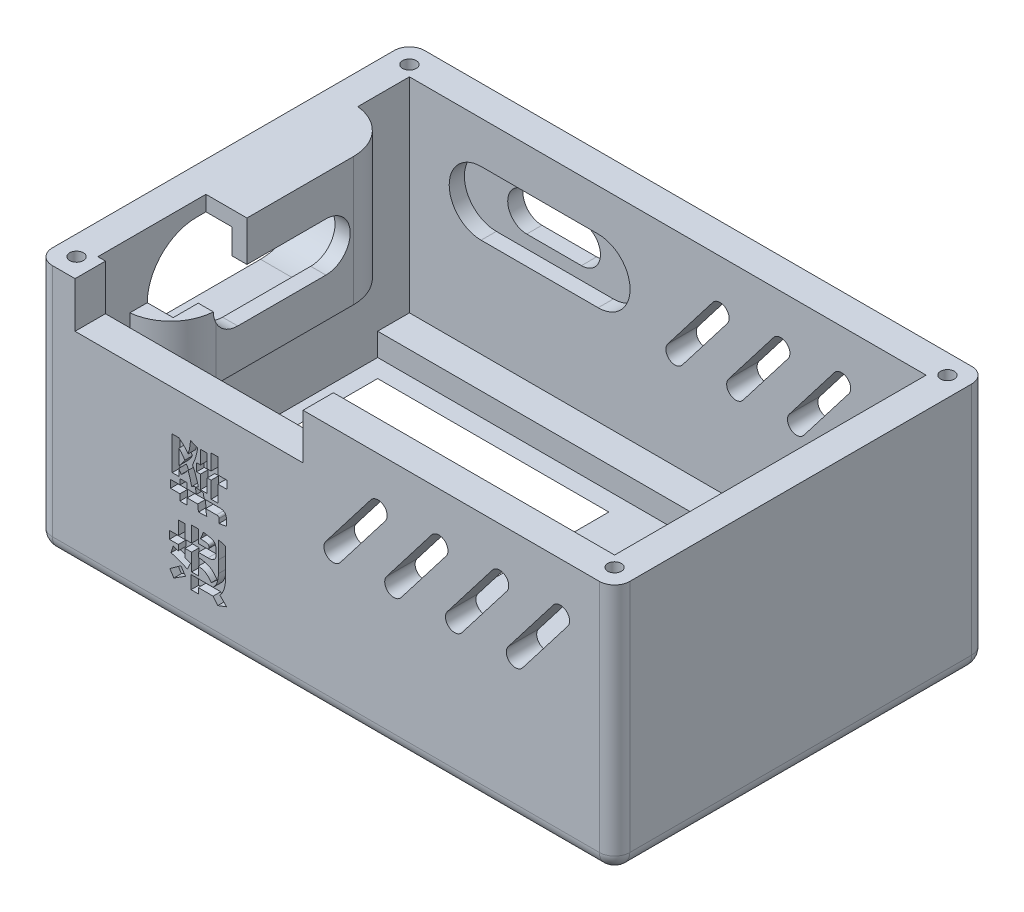
from build123d import *

# Parameters (mm, degrees)
SKETCH_1_W           = 38
SKETCH_1_H           = 24.5
EXTRUDE_1_DEPTH      = 16.45
SKETCH_2_W           = 34
SKETCH_2_H           = 20.5
CUT_EXTRUDE_1_DEPTH  = 13.45
SKETCH_4_W           = 15.21
SKETCH_4_H           = 15.21
CUT_EXTRUDE_2_DEPTH  = 15
SKETCH_6_W           = 15
SKETCH_6_H           = 3
CUT_EXTRUDE_4_DEPTH  = 5
SKETCH_11_W          = 32.5
SKETCH_11_H          = 17.6
CUT_EXTRUDE_10_DEPTH = 1.5
FILLET_2_R           = 1
CHAMFER_2_SIZE       = 1.5
FILLET_8_R           = 1
SKETCH_24_W          = 7
SKETCH_24_H          = 9.5
CUT_EXTRUDE_17_DEPTH = 1
SKETCH_29_R          = 0.45
CUT_EXTRUDE_18_DEPTH = 6
CUT_EXTRUDE_19_DEPTH = 1
CUT_EXTRUDE_20_REACH = 79.65
SKETCH_37_W          = 3
SKETCH_37_H          = 15
EXTRUDE_8_DEPTH      = 10
CUT_EXTRUDE_21_DEPTH = 3.7
CUT_EXTRUDE_24_DEPTH = 9
FILLET_9_R           = 3
SKETCH_42_W          = 0.402439024
SKETCH_42_H          = 0.439596036
SKETCH_42_H_2        = 0.416730183
SKETCH_42_W_2        = 0.365853658
SKETCH_42_W_3        = 1.207317074
SKETCH_42_H_3        = 0.173780487
CUT_EXTRUDE_26_DEPTH = 0.5
CUT_EXTRUDE_27_DEPTH = 0.5
CUT_EXTRUDE_START    = -2.7
SKETCH_46_W          = 15
SKETCH_46_H          = 5
CUT_EXTRUDE_29_DEPTH = 2.7
SKETCH_48_W          = 1.781169501
SKETCH_48_H          = 2
EXTRUDE_9_DEPTH      = 1.4
SKETCH_49_W          = 1
SKETCH_49_H          = 7
CUT_EXTRUDE_30_DEPTH = 1.5
CUT_EXTRUDE_31_DEPTH = 78.958761426
SKETCH_51_W          = 2
SKETCH_51_H          = 19
CUT_EXTRUDE_32_DEPTH = 0.5
SKETCH_52_W          = 2
SKETCH_52_H          = 0.5
EXTRUDE_10_DEPTH     = 0.5
SKETCH_53_W          = 2.7
SKETCH_53_H          = 5.005825876
CUT_EXTRUDE_33_DEPTH = 4.25
SKETCH_54_R          = 2
CUT_EXTRUDE_34_DEPTH = 0.5


# Some blends are built 0.0001 mm under size
with BuildPart() as part:
    # 草图1 → 凸台-拉伸1 (new body)
    with BuildSketch(Plane(origin=(0, 0, 0), x_dir=(1, 0, 0), z_dir=(0, 1, 0))):
        with Locations((-53.157577391, -18.500418409)):
            Rectangle(SKETCH_1_W, SKETCH_1_H)
    extrude(amount=EXTRUDE_1_DEPTH)

    # 草图2 → 切除-拉伸1 (cut)
    with BuildSketch(Plane(origin=(0, 16.45, 0), x_dir=(1, 0, 0), z_dir=(0, 1, 0))):
        with Locations((-53.157577391, -18.500418409)):
            Rectangle(SKETCH_2_W, SKETCH_2_H)
    extrude(amount=-CUT_EXTRUDE_1_DEPTH, mode=Mode.SUBTRACT)

    # 草图4 → 切除-拉伸2 (cut)
    with BuildSketch(Plane(origin=(0, 0, 0), x_dir=(-1, 0, 0), z_dir=(0, -1, 0))):
        with Locations((61.352577391, -19.145418409)):
            Rectangle(SKETCH_4_W, SKETCH_4_H)
    extrude(amount=-CUT_EXTRUDE_2_DEPTH, mode=Mode.SUBTRACT)

    # 草图6 → 切除-拉伸4 (cut)
    with BuildSketch(Plane.XY.offset(30.750418409)):
        with Locations((-62.157577391, 14.95)):
            Rectangle(SKETCH_6_W, SKETCH_6_H)
    extrude(amount=-CUT_EXTRUDE_4_DEPTH, mode=Mode.SUBTRACT)

    # 草图11 → 切除-拉伸10 (cut)
    with BuildSketch(Plane(origin=(0, 3, 0), x_dir=(1, 0, 0), z_dir=(0, 1, 0))):
        with Locations((-53.907577391, -19.140418409)):
            Rectangle(SKETCH_11_W, SKETCH_11_H)
    extrude(amount=-CUT_EXTRUDE_10_DEPTH, mode=Mode.SUBTRACT)

    # 圆角2
    fillet_2_edges = [part.edges().sort_by_distance(p)[0] for p in [
        (-72.157577391, 0, 18.500418409),
        (-53.157577391, 0, 30.750418409),
        (-34.157577391, 0, 18.500418409),
        (-53.157577391, 0, 6.250418409),
        (-72.157577391, 8.225, 6.250418409),
        (-72.157577391, 8.225, 30.750418409),
        (-34.157577391, 8.225, 30.750418409),
        (-34.157577391, 8.225, 6.250418409),
    ]]
    fillet(fillet_2_edges, radius=FILLET_2_R)

    # 倒角2
    chamfer_2_edges = [part.edges().sort_by_distance(p)[0] for p in [
        (-61.352577391, 0, 26.750418409),
        (-53.747577391, 0, 19.145418409),
        (-61.352577391, 0, 11.540418409),
        (-68.957577391, 0, 19.145418409),
    ]]
    chamfer(chamfer_2_edges, length=CHAMFER_2_SIZE - 0.0001)  # a hair under: the kernel refuses the full size

    # 圆角8
    fillet_8_edges = [part.edges().sort_by_distance(p)[0] for p in [
        (-37.657577391, 3, 19.140418409),
    ]]
    fillet(fillet_8_edges, radius=FILLET_8_R)

    # 草图24 → 切除-拉伸17 (cut)
    with BuildSketch(Plane.ZY.offset(36.157577391)):
        with Locations((19.140418409, 7.75)):
            Rectangle(SKETCH_24_W, SKETCH_24_H)
    extrude(amount=-CUT_EXTRUDE_17_DEPTH, mode=Mode.SUBTRACT)

    # 草图29 → 切除-拉伸18 (cut)
    with BuildSketch(Plane(origin=(0, 16.45, 0), x_dir=(1, 0, 0), z_dir=(0, 1, 0))):
        with Locations(Location((-70.857577391, -7.550418409, 0), (0, 0, 270))):
            Circle(SKETCH_29_R)
        with Locations(Location((-70.857577391, -29.450418409, 0), (0, 0, 270))):
            Circle(SKETCH_29_R)
        with Locations(Location((-35.457577391, -7.550418409, 0), (0, 0, 270))):
            Circle(SKETCH_29_R)
        with Locations(Location((-35.457577391, -29.450418409, 0), (0, 0, 270))):
            Circle(SKETCH_29_R)
    extrude(amount=-CUT_EXTRUDE_18_DEPTH, mode=Mode.SUBTRACT)

    # 草图32 → 切除-拉伸19 (cut)
    with BuildSketch(Plane.XY.offset(8.250418409)):
        with BuildLine():
            Line((-57.739407383, 9.5), (-65.439407383, 9.5))
            ThreePointArc((-65.439407383, 9.5), (-67.539407383, 11.6), (-65.439407383, 13.7))
            Line((-65.439407383, 13.7), (-57.739407383, 13.7))
            ThreePointArc((-57.739407383, 13.7), (-55.639407383, 11.6), (-57.739407383, 9.5))
        make_face()
    extrude(amount=-CUT_EXTRUDE_19_DEPTH, mode=Mode.SUBTRACT)

    # 草图33 → 切除-拉伸20 (cut, up to next)
    with BuildSketch(Plane.XY.offset(7.250418409), mode=Mode.PRIVATE) as cut_extrude_20_sk1:
        with BuildLine():
            Line((-63.439407383, 12.85), (-59.839407383, 12.85))
            ThreePointArc((-59.839407383, 12.85), (-58.589407383, 11.6), (-59.839407383, 10.35))
            Line((-59.839407383, 10.35), (-63.439407383, 10.35))
            ThreePointArc((-63.439407383, 10.35), (-64.689407383, 11.6), (-63.439407383, 12.85))
        make_face()
    cut_extrude_20_tool1 = extrude(cut_extrude_20_sk1.sketch, amount=-CUT_EXTRUDE_20_REACH, mode=Mode.PRIVATE) & part.part
    add(cut_extrude_20_tool1.solids().sort_by_distance((-61.639407, 11.6, 7.250418))[0], mode=Mode.SUBTRACT)

    # 草图37 → 凸台-拉伸8 (add)
    with BuildSketch(Plane(origin=(0, 16.45, 0), x_dir=(1, 0, 0), z_dir=(0, 1, 0))):
        with Locations((-68.957577391, -19.145418409)):
            Rectangle(SKETCH_37_W, SKETCH_37_H)
    extrude(amount=-EXTRUDE_8_DEPTH)

    # 草图34 → 切除-拉伸21 (cut)
    with BuildSketch(Plane.ZY.offset(72.157577391)):
        with BuildLine():
            Line((22.245418409, 8.95), (16.045418409, 8.95))
            ThreePointArc((16.045418409, 8.95), (12.795418409, 12.2), (16.045418409, 15.45))
            Line((16.045418409, 15.45), (22.245418409, 15.45))
            ThreePointArc((22.245418409, 15.45), (25.495418409, 12.2), (22.245418409, 8.95))
        make_face()
    extrude(amount=-CUT_EXTRUDE_21_DEPTH, mode=Mode.SUBTRACT)

    # 草图39 → 切除-拉伸24 (cut)
    with BuildSketch(Plane.ZY.offset(68.457577391)):
        with BuildLine():
            Line((22.245418409, 10.6), (16.445418409, 10.6))
            ThreePointArc((16.445418409, 10.6), (14.845418409, 12.2), (16.445418409, 13.8))
            Line((16.445418409, 13.8), (22.245418409, 13.8))
            ThreePointArc((22.245418409, 13.8), (23.845418409, 12.2), (22.245418409, 10.6))
        make_face()
    extrude(amount=-CUT_EXTRUDE_24_DEPTH, mode=Mode.SUBTRACT)

    # 圆角9
    # the kernel refuses this fillet: 3 mm, written as the material it takes off along each edge
    with BuildSketch(Plane(origin=(-67.457577391, 23.912405778, 11.645418409), x_dir=(-1, 0, 0), z_dir=(0, -1, 0))) as fillet_9_piece_1:
        with BuildLine():
            CenterArc((3, -2.984962311), FILLET_9_R, 95.739170477, 84.260829523)
            Line((0, -2.984962311), (0, 0))
            Line((0, 0), (2.7, 0))
        make_face()
    extrude(amount=17.462405778, mode=Mode.SUBTRACT)
    with BuildSketch(Plane(origin=(-67.457577391, 23.912405778, 26.645418409), x_dir=(-1, 0, 0), z_dir=(0, -1, 0))) as fillet_9_piece_2:
        with BuildLine():
            CenterArc((3, 2.984962311), FILLET_9_R, 180, 84.260829523)
            Line((0, 2.984962311), (0, 0))
            Line((0, 0), (2.7, 0))
        make_face()
    extrude(amount=17.462405778, mode=Mode.SUBTRACT)

    # 草图42 → 切除-拉伸26 (cut)
    # profile 1 of 5: a face of its own
    with BuildSketch(Plane(origin=(0, 0, 6.250418409), x_dir=(-1, 0, 0), z_dir=(0, 0, -1))):
        with BuildLine():
            Line((63.194162757, 5.822389145), (62.78429233, 5.822389145))
            Line((62.78429233, 5.822389145), (62.462455439, 6.067625426))
            Line((62.462455439, 6.067625426), (62.462455439, 5.536565975))
            Line((62.462455439, 5.536565975), (60.24046611, 5.536565975))
            add(Edge.make_bspline(
                [(60.24046611, 5.536565975), (60.207458635, 5.537244083), (60.144443277, 5.538538675), (60.054998162, 5.55064275), (59.97500657, 5.56967737), (59.90502255, 5.596808335), (59.845188782, 5.631318251), (59.7957107, 5.672052043), (59.756987607, 5.719399763), (59.73314879, 5.764635935), (59.719567917, 5.8070847), (59.71098411, 5.846757251), (59.702697088, 5.894197658), (59.697096149, 5.949441031), (59.691116931, 6.012669673), (59.686613383, 6.083581422), (59.684074838, 6.162508318), (59.682693855, 6.217586606), (59.681967635, 6.246550731)],
                knots=[0, 0, 0, 0, 1.475646756, 2.817192359, 4.028506436, 5.145868062, 6.161795844, 7.105710132, 7.996207694, 8.880607428, 9.373825128, 9.985805558, 10.694785791, 11.526793844, 12.468165234, 13.535691848, 14.704089542, 16, 16, 16, 16], degree=3))
            add(Edge.make_bspline(
                [(59.681967635, 6.246550731), (59.723169459, 6.254725188), (59.804858911, 6.270932406), (59.925510252, 6.298695433), (60.042818628, 6.330894307), (60.119531624, 6.354760191), (60.157577391, 6.366596462)],
                knots=[0, 0, 0, 0, 1.026886247, 2.035972309, 3.025941605, 4, 4, 4, 4], degree=3))
            add(Edge.make_bspline(
                [(60.157577391, 6.366596462), (60.157577391, 6.339347987), (60.157577391, 6.289614755), (60.157577391, 6.222160487), (60.157577391, 6.168997377), (60.157577391, 6.138319023), (60.157577391, 6.125361706)],
                knots=[0, 0, 0, 0, 1.355450237, 2.473933649, 3.355450237, 4, 4, 4, 4], degree=3))
            add(Edge.make_bspline(
                [(60.157577391, 6.125361706), (60.157853857, 6.11368169), (60.15837824, 6.091527877), (60.166591596, 6.060844023), (60.179413534, 6.03463189), (60.197339645, 6.012801374), (60.221366024, 5.996663789), (60.249600587, 5.984537955), (60.283227646, 5.977822952), (60.307128847, 5.977113487), (60.319924952, 5.976733658)],
                knots=[0, 0, 0, 0, 1.109159119, 2.103773063, 2.996338341, 3.872149079, 4.758050567, 5.725313047, 6.782189532, 8, 8, 8, 8], degree=3))
            Line((60.319924952, 5.976733658), (60.560016415, 5.976733658))
            Line((60.560016415, 5.976733658), (60.560016415, 6.416329694))
            Line((60.560016415, 6.416329694), (59.718553, 6.416329694))
            Line((59.718553, 6.416329694), (59.718553, 6.848494328))
            Line((59.718553, 6.848494328), (60.560016415, 6.848494328))
            Line((60.560016415, 6.848494328), (60.560016415, 7.288662011))
            add(Edge.make_bspline(
                [(60.560016415, 7.288662011), (60.510988402, 7.293936238), (60.415139465, 7.304247263), (60.275949441, 7.326737499), (60.144682984, 7.353438089), (60.021586394, 7.384780478), (59.90643745, 7.420660529), (59.799479324, 7.461155226), (59.700170997, 7.505995142), (59.638839053, 7.541223313), (59.608796903, 7.558479084)],
                knots=[0, 0, 0, 0, 1.187442717, 2.321430437, 3.394272281, 4.412731722, 5.379417514, 6.297379922, 7.166007713, 8, 8, 8, 8], degree=3))
            add(Edge.make_bspline(
                [(59.608796903, 7.558479084), (59.638505032, 7.589594135), (59.698009803, 7.65191694), (59.780603736, 7.751159107), (59.860573807, 7.852700024), (59.90876476, 7.924023878), (59.932920379, 7.959774816)],
                knots=[0, 0, 0, 0, 0.999053977, 2.001084541, 2.998047654, 4, 4, 4, 4], degree=3))
            add(Edge.make_bspline(
                [(59.932920379, 7.959774816), (59.951119597, 7.948944037), (59.988141642, 7.926911357), (60.046592823, 7.896224489), (60.109649226, 7.869418), (60.175992269, 7.843290287), (60.246565142, 7.820219191), (60.320729961, 7.798109947), (60.399328714, 7.779733102), (60.481597078, 7.762356236), (60.567995077, 7.747634638), (60.65816994, 7.735072075), (60.752374284, 7.725002212), (60.850292466, 7.716102979), (60.952319338, 7.710800981), (61.058082296, 7.706830874), (61.167856611, 7.704151191), (61.242370607, 7.704973646), (61.280290805, 7.705392194)],
                knots=[0, 0, 0, 0, 0.732243618, 1.489577996, 2.280308531, 3.100068032, 3.954290147, 4.846637571, 5.775079418, 6.744194696, 7.753699183, 8.804725962, 9.891729642, 11.029253874, 12.20385721, 13.423603062, 14.688870728, 16, 16, 16, 16], degree=3))
            Line((61.280290805, 7.705392194), (62.112036232, 7.705392194))
            Line((62.112036232, 7.705392194), (62.023431049, 7.797998901))
            add(Edge.make_bspline(
                [(62.023431049, 7.797998901), (62.060955517, 7.817106275), (62.135680615, 7.855156124), (62.244568353, 7.918069955), (62.350855013, 7.984438704), (62.41921811, 8.032443995), (62.453309098, 8.056383048)],
                knots=[0, 0, 0, 0, 1.006257553, 2.003831074, 3.004559839, 4, 4, 4, 4], degree=3))
            add(Edge.make_bspline(
                [(62.453309098, 8.056383048), (62.489803426, 8.010825782), (62.562318261, 7.920302737), (62.678814056, 7.7923059), (62.800255585, 7.671467254), (62.926606731, 7.557352818), (63.058792008, 7.451008177), (63.19639479, 7.352138877), (63.338520082, 7.259469118), (63.437352828, 7.204264405), (63.486845683, 7.176619328)],
                knots=[0, 0, 0, 0, 1.02456789, 2.035833422, 3.03641921, 4.031267882, 5.023385018, 6.013085383, 7.005005107, 8, 8, 8, 8], degree=3))
            Line((63.486845683, 7.176619328), (63.390809098, 6.678715365))
            add(Edge.make_bspline(
                [(63.390809098, 6.678715365), (63.357682697, 6.695761374), (63.291155771, 6.729994451), (63.226582453, 6.767783929), (63.194162757, 6.786756523)],
                knots=[0, 0, 0, 0, 0.995879497, 2, 2, 2, 2], degree=3))
            Line((63.194162757, 6.786756523), (63.194162757, 5.822389145))
        make_face()
        with BuildLine():
            Line((62.462455439, 7.33096384), (62.462455439, 6.61697756))
            Line((62.462455439, 6.61697756), (62.791723732, 6.374027865))
            Line((62.791723732, 6.374027865), (62.791723732, 7.061146767))
            add(Edge.make_bspline(
                [(62.791723732, 7.061146767), (62.735792802, 7.104004427), (62.623098974, 7.190357252), (62.516266184, 7.283864869), (62.462455439, 7.33096384)],
                knots=[0, 0, 0, 0, 0.992617449, 2, 2, 2, 2], degree=3))
        make_face(mode=Mode.SUBTRACT)
        with Locations((61.858796903, 6.196531676)):
            Rectangle(SKETCH_42_W, SKETCH_42_H, mode=Mode.SUBTRACT)
        with Locations((61.858796903, 7.05685942)):
            Rectangle(SKETCH_42_W, SKETCH_42_H_2, mode=Mode.SUBTRACT)
        with Locations((61.108796903, 6.196531676)):
            Rectangle(SKETCH_42_W_2, SKETCH_42_H, mode=Mode.SUBTRACT)
        with BuildLine():
            Line((60.925870074, 7.267511097), (60.925870074, 6.848494328))
            Line((60.925870074, 6.848494328), (61.291723732, 6.848494328))
            Line((61.291723732, 6.848494328), (61.291723732, 7.265224511))
            add(Edge.make_bspline(
                [(61.291723732, 7.265224511), (61.22979474, 7.265313697), (61.107839825, 7.265489329), (60.98589234, 7.266844221), (60.925870074, 7.267511097)],
                knots=[0, 0, 0, 0, 1.015604697, 2, 2, 2, 2], degree=3))
        make_face(mode=Mode.SUBTRACT)
    # profile 2 of 5: a face of its own
    with BuildSketch(Plane(origin=(0, 0, 6.250418409), x_dir=(-1, 0, 0), z_dir=(0, 0, -1))):
        with BuildLine():
            Line((62.755138366, 7.805430304), (62.755138366, 8.272465365))
            add(Edge.make_bspline(
                [(62.755138366, 8.272465365), (62.701893946, 8.286074485), (62.595772883, 8.313198723), (62.438900419, 8.359014763), (62.284641496, 8.408668412), (62.183579867, 8.445186232), (62.133187147, 8.463395243)],
                knots=[0, 0, 0, 0, 1.013067125, 2.019136644, 3.012275052, 4, 4, 4, 4], degree=3))
            Line((62.133187147, 8.463395243), (62.133187147, 7.917472987))
            Line((62.133187147, 7.917472987), (60.047821293, 7.917472987))
            Line((60.047821293, 7.917472987), (60.047821293, 8.519416584))
            Line((60.047821293, 8.519416584), (59.828309098, 8.519416584))
            Line((59.828309098, 8.519416584), (59.828309098, 8.947579694))
            Line((59.828309098, 8.947579694), (61.109940196, 8.947579694))
            add(Edge.make_bspline(
                [(61.109940196, 8.947579694), (61.07899744, 8.96785832), (61.017199069, 9.008358464), (60.956284441, 9.050176012), (60.925870074, 9.071055304)],
                knots=[0, 0, 0, 0, 1.001410065, 2, 2, 2, 2], degree=3))
            add(Edge.make_bspline(
                [(60.925870074, 9.071055304), (60.978623438, 9.083796513), (61.08241612, 9.108864947), (61.232745257, 9.156073347), (61.375662849, 9.209415782), (61.466497996, 9.251148876), (61.511235927, 9.27170317)],
                knots=[0, 0, 0, 0, 1.050035227, 2.065953034, 3.047447358, 4, 4, 4, 4], degree=3))
            add(Edge.make_bspline(
                [(61.511235927, 9.27170317), (61.557070622, 9.242658591), (61.648953523, 9.184434135), (61.792394969, 9.105132019), (61.940585009, 9.03183288), (62.093832944, 8.965027151), (62.252050967, 8.904477186), (62.414927363, 8.849335759), (62.58313391, 8.801432143), (62.697484035, 8.774320695), (62.755138366, 8.76065134)],
                knots=[0, 0, 0, 0, 0.96303068, 1.930547446, 2.907735855, 3.89684036, 4.896867155, 5.914072857, 6.948293812, 8, 8, 8, 8], degree=3))
            Line((62.755138366, 8.76065134), (62.755138366, 9.140796158))
            Line((62.755138366, 9.140796158), (63.194162757, 9.140796158))
            Line((63.194162757, 9.140796158), (63.194162757, 7.805430304))
            Line((63.194162757, 7.805430304), (62.755138366, 7.805430304))
        make_face()
        with Locations((61.09050422, 8.432526341)):
            Rectangle(SKETCH_42_W_3, SKETCH_42_H_3, mode=Mode.SUBTRACT)
    # profile 3 of 5: a face of its own
    with BuildSketch(Plane(origin=(0, 0, 6.250418409), x_dir=(-1, 0, 0), z_dir=(0, 0, -1))):
        with BuildLine():
            add(Edge.make_bspline(
                [(63.450260318, 4.774987964), (63.415012925, 4.738970318), (63.346874915, 4.669343301), (63.248230553, 4.568675465), (63.155767891, 4.476110443), (63.070945886, 4.390202813), (62.992180404, 4.312318006), (62.919162427, 4.24302434), (62.854471697, 4.179622208), (62.812579815, 4.140941308), (62.792867025, 4.122739489)],
                knots=[0, 0, 0, 0, 1.30590995, 2.524501781, 3.652274007, 4.696249751, 5.652956688, 6.522524947, 7.304754179, 8, 8, 8, 8], degree=3))
            Line((62.792867025, 4.122739489), (62.425870074, 4.562907172))
            add(Edge.make_bspline(
                [(62.425870074, 4.562907172), (62.449170783, 4.582088407), (62.497524571, 4.621893433), (62.571827038, 4.68524382), (62.652063567, 4.752997279), (62.736742397, 4.8267173), (62.827152161, 4.9052863), (62.92195432, 4.989640477), (63.022462123, 5.079099265), (63.09091157, 5.140621674), (63.126136842, 5.172282172)],
                knots=[0, 0, 0, 0, 0.780204063, 1.619084668, 2.524210179, 3.495059759, 4.521505653, 5.620727373, 6.775585056, 8, 8, 8, 8], degree=3))
            Line((63.126136842, 5.172282172), (63.450260318, 4.774987964))
        make_face()
    # profile 4 of 5: a face of its own
    with BuildSketch(Plane(origin=(0, 0, 6.250418409), x_dir=(-1, 0, 0), z_dir=(0, 0, -1))):
        with BuildLine():
            Line((63.413674952, 3.220109916), (63.413674952, 2.645033696))
            add(Edge.make_bspline(
                [(63.413674952, 2.645033696), (63.334972255, 2.646109395), (63.180973091, 2.648214236), (62.954996631, 2.655657158), (62.738850668, 2.663518511), (62.598113904, 2.671837325), (62.529338061, 2.675902599)],
                knots=[0, 0, 0, 0, 1.067272862, 2.08835448, 3.065808904, 4, 4, 4, 4], degree=3))
            add(Edge.make_bspline(
                [(62.529338061, 2.675902599), (62.458573763, 2.669068066), (62.319964438, 2.655680949), (62.116994229, 2.625842589), (61.922863231, 2.591163402), (61.738054593, 2.548362191), (61.56180401, 2.501023509), (61.395161444, 2.445136145), (61.236778572, 2.384481578), (61.087892455, 2.316089459), (60.94768116, 2.242155929), (60.816643512, 2.16119724), (60.694743453, 2.07375719), (60.581551282, 1.979674279), (60.477536722, 1.879209738), (60.382480694, 1.772074375), (60.296442762, 1.658620953), (60.246517572, 1.577993082), (60.221601781, 1.537754733)],
                knots=[0, 0, 0, 0, 1.275663444, 2.498701336, 3.680539334, 4.813687858, 5.902094592, 6.954271702, 7.966526386, 8.944323783, 9.892763063, 10.809478394, 11.706288618, 12.582835178, 13.448609686, 14.29885411, 15.151021825, 16, 16, 16, 16], degree=3))
            add(Edge.make_bspline(
                [(60.221601781, 1.537754733), (60.168821881, 1.573580078), (60.066630362, 1.642944484), (59.918488895, 1.743439469), (59.778616795, 1.834037182), (59.688653578, 1.891821077), (59.645382269, 1.919614489)],
                knots=[0, 0, 0, 0, 1.107316082, 2.143966024, 3.107268246, 4, 4, 4, 4], degree=3))
            add(Edge.make_bspline(
                [(59.645382269, 1.919614489), (59.672937959, 1.951295403), (59.727474531, 2.01399637), (59.813256582, 2.103100743), (59.899954685, 2.188575698), (59.988977425, 2.26912266), (60.080323629, 2.344537467), (60.172623719, 2.416430724), (60.268025317, 2.48259742), (60.364694306, 2.544905983), (60.463664703, 2.602196424), (60.563929521, 2.655502276), (60.66665729, 2.703555227), (60.771195136, 2.747009528), (60.877749311, 2.785709769), (60.985836203, 2.82098545), (61.096187832, 2.850663406), (61.170843033, 2.866764819), (61.208263366, 2.874835525)],
                knots=[0, 0, 0, 0, 1.079272581, 2.136031632, 3.178708772, 4.208789878, 5.221105986, 6.223464489, 7.215511513, 8.204760741, 9.179383668, 10.154511208, 11.123120211, 12.093808043, 13.063939482, 14.036812702, 15.015967784, 16, 16, 16, 16], degree=3))
            add(Edge.make_bspline(
                [(61.208263366, 2.874835525), (61.170637382, 2.886573621), (61.095724696, 2.909943967), (60.98538217, 2.949588019), (60.876887346, 2.99263374), (60.770267002, 3.039075659), (60.66595674, 3.090560471), (60.56322492, 3.144567666), (60.462348207, 3.202222476), (60.364046857, 3.264530334), (60.266749121, 3.329009318), (60.172475483, 3.398969435), (60.079083265, 3.471096467), (59.988403567, 3.547891438), (59.899462062, 3.628054768), (59.812826241, 3.712240063), (59.727245491, 3.799420385), (59.672769925, 3.860509895), (59.645382269, 3.891222721)],
                knots=[0, 0, 0, 0, 1.001244248, 1.993460044, 2.977803245, 3.966268411, 4.947022045, 5.932305192, 6.914634603, 7.897810547, 8.888679171, 9.879192971, 10.879500557, 11.886102055, 12.897209984, 13.920848693, 14.954704169, 16, 16, 16, 16], degree=3))
            add(Edge.make_bspline(
                [(59.645382269, 3.891222721), (59.691691358, 3.918338655), (59.784528882, 3.97269896), (59.920792781, 4.060441591), (60.054677928, 4.154062725), (60.141436555, 4.22073027), (60.185016415, 4.254218147)],
                knots=[0, 0, 0, 0, 0.98921624, 1.983117977, 2.986896865, 4, 4, 4, 4], degree=3))
            add(Edge.make_bspline(
                [(60.185016415, 4.254218147), (60.231294466, 4.199194303), (60.321388613, 4.092073837), (60.462985887, 3.944267725), (60.6054707, 3.812193224), (60.749076676, 3.695865076), (60.893262366, 3.59448253), (61.038861341, 3.509301516), (61.185826442, 3.440305039), (61.310929114, 3.39490392), (61.415028197, 3.366015182), (61.499449019, 3.345440984), (61.590989755, 3.326679217), (61.68960261, 3.309714464), (61.794973608, 3.293710418), (61.907426813, 3.279392432), (62.026781085, 3.267116329), (62.153286601, 3.255495559), (62.286701714, 3.245905551), (62.427167659, 3.238089804), (62.57445548, 3.231039924), (62.728826048, 3.226190431), (62.89002764, 3.221999044), (63.058294665, 3.219788287), (63.233606825, 3.219334577), (63.352890057, 3.219848188), (63.413674952, 3.220109916)],
                knots=[0, 0, 0, 0, 1.457385854, 2.837239969, 4.146770695, 5.393891392, 6.581364357, 7.717057281, 8.809314679, 9.868812931, 10.410620327, 10.999054358, 11.630185978, 12.30469811, 13.027540547, 13.790873929, 14.602755917, 15.460025117, 16.366410153, 17.314452573, 18.312250848, 19.355910019, 20.445684552, 21.581587721, 22.767614427, 24, 24, 24, 24], degree=3))
        make_face()
    # profile 5 of 5: a face of its own
    with BuildSketch(Plane(origin=(0, 0, 6.250418409), x_dir=(-1, 0, 0), z_dir=(0, 0, -1))):
        with BuildLine():
            add(Edge.make_bspline(
                [(61.255138366, 4.007266928), (61.21693071, 3.997515252), (61.138888614, 3.977596699), (61.021600721, 3.940544768), (60.900844221, 3.898489507), (60.820545474, 3.865680063), (60.77952861, 3.848920891)],
                knots=[0, 0, 0, 0, 0.942865896, 1.925876597, 2.940530961, 4, 4, 4, 4], degree=3))
            add(Edge.make_bspline(
                [(60.77952861, 3.848920891), (60.694144384, 3.93580173), (60.524193229, 4.108731784), (60.260790634, 4.356796024), (59.993663392, 4.595571535), (59.809983024, 4.74627574), (59.718553, 4.821291318)],
                knots=[0, 0, 0, 0, 1.015010601, 2.02030551, 3.01457343, 4, 4, 4, 4], degree=3))
            Line((59.718553, 4.821291318), (60.075260318, 5.110544367))
            add(Edge.make_bspline(
                [(60.075260318, 5.110544367), (60.088195505, 5.099409271), (60.113718042, 5.077438512), (60.155357326, 5.049527735), (60.1980621, 5.025366988), (60.242701879, 5.005729623), (60.288796998, 4.990312867), (60.336468453, 4.979428106), (60.385679963, 4.973023334), (60.418991319, 4.972103248), (60.435969159, 4.971634306)],
                knots=[0, 0, 0, 0, 1.034592192, 2.04136327, 3.035041492, 4.008063953, 4.99506293, 5.979350366, 6.970133033, 8, 8, 8, 8], degree=3))
            Line((60.435969159, 4.971634306), (61.730748122, 4.971634306))
            Line((61.730748122, 4.971634306), (61.730748122, 5.365498635))
            Line((61.730748122, 5.365498635), (62.242943244, 5.365498635))
            Line((62.242943244, 5.365498635), (62.242943244, 4.458295891))
            Line((62.242943244, 4.458295891), (60.83269172, 4.458295891))
            Line((60.83269172, 4.458295891), (61.255138366, 4.007266928))
        make_face()
    extrude(amount=-CUT_EXTRUDE_26_DEPTH, mode=Mode.SUBTRACT)

    # 草图43 → 切除-拉伸27 (cut)
    # profile 1 of 6: a face of its own
    with BuildSketch(Plane.XY.offset(30.750418409)):
        with BuildLine():
            add(Edge.make_bspline(
                [(-61.40147983, 5.763420846), (-61.367413251, 5.839149917), (-61.298804343, 5.991665644), (-61.238963108, 6.147830507), (-61.208835013, 6.226454382)],
                knots=[0, 0, 0, 0, 0.993065738, 2, 2, 2, 2], degree=3))
            add(Edge.make_bspline(
                [(-61.208835013, 6.226454382), (-61.172810523, 6.220999061), (-61.104326365, 6.210628253), (-61.006704885, 6.194726959), (-60.919457873, 6.178701006), (-60.842254055, 6.163371688), (-60.775312102, 6.148655178), (-60.718689806, 6.134402215), (-60.672081145, 6.121195636), (-60.624383125, 6.102990821), (-60.57400227, 6.077655208), (-60.522035506, 6.038467996), (-60.477664196, 5.991047942), (-60.440673969, 5.935479353), (-60.412288504, 5.872007724), (-60.391726626, 5.801250008), (-60.378996801, 5.72310061), (-60.377741938, 5.668388054), (-60.377089586, 5.639945236)],
                knots=[0, 0, 0, 0, 1.514070973, 2.878316293, 4.109934566, 5.20007312, 6.149112157, 6.957630954, 7.626573948, 8.160398083, 9.077621545, 9.959720184, 10.850413134, 11.764006455, 12.720776763, 13.727987901, 14.818873894, 16, 16, 16, 16], degree=3))
            Line((-60.377089586, 5.639945236), (-60.377089586, 5.370128163))
            add(Edge.make_bspline(
                [(-60.377089586, 5.370128163), (-60.377543818, 5.35162605), (-60.378426922, 5.315654779), (-60.384816194, 5.263437498), (-60.3949348, 5.214793518), (-60.409148378, 5.16961134), (-60.42819345, 5.128269642), (-60.451155108, 5.090256888), (-60.47804752, 5.055729728), (-60.509398295, 5.02499935), (-60.545091592, 4.998187084), (-60.58492106, 4.974535514), (-60.628846164, 4.954681296), (-60.676965813, 4.938677723), (-60.728951158, 4.92602146), (-60.78525384, 4.918012553), (-60.845511125, 4.911763035), (-60.887170104, 4.911323517), (-60.908720683, 4.911096151)],
                knots=[0, 0, 0, 0, 1.103747174, 2.145873251, 3.13368375, 4.064915599, 4.965380043, 5.842797498, 6.709319537, 7.56955367, 8.454087121, 9.366600594, 10.328220385, 11.324110735, 12.388510782, 13.515665654, 14.714830628, 16, 16, 16, 16], degree=3))
            Line((-60.908720683, 4.911096151), (-61.547821293, 4.911096151))
            Line((-61.547821293, 4.911096151), (-61.547821293, 4.619556517))
            add(Edge.make_bspline(
                [(-61.547821293, 4.619556517), (-61.505304716, 4.617025711), (-61.423000125, 4.612126518), (-61.303748254, 4.599653367), (-61.193113495, 4.582603116), (-61.090708522, 4.561707988), (-60.996983838, 4.536012926), (-60.911349147, 4.506623551), (-60.834445123, 4.472360864), (-60.765159294, 4.433401631), (-60.70135008, 4.389355918), (-60.639732116, 4.341411689), (-60.57944965, 4.288698006), (-60.521108148, 4.230612144), (-60.464071681, 4.167833706), (-60.408484338, 4.100164641), (-60.354582953, 4.027531535), (-60.321002942, 3.976249022), (-60.303918854, 3.950158651)],
                knots=[0, 0, 0, 0, 1.376366742, 2.664403143, 3.873280802, 4.992859114, 6.04012194, 7.01195643, 7.916091099, 8.757076493, 9.576941135, 10.419503307, 11.279197143, 12.163162702, 13.078634926, 14.019298497, 14.992302933, 16, 16, 16, 16], degree=3))
            add(Edge.make_bspline(
                [(-60.303918854, 3.950158651), (-60.33456043, 3.925765104), (-60.398190669, 3.875109512), (-60.494184692, 3.792450701), (-60.594695144, 3.701000702), (-60.662302825, 3.63610571), (-60.697211537, 3.602597675)],
                knots=[0, 0, 0, 0, 0.89497002, 1.858493043, 2.89424917, 4, 4, 4, 4], degree=3))
            add(Edge.make_bspline(
                [(-60.697211537, 3.602597675), (-60.717123499, 3.632665317), (-60.757469197, 3.693588496), (-60.82774067, 3.779813769), (-60.906450906, 3.862714244), (-60.978084327, 3.929207865), (-61.041714682, 3.979163739), (-61.096978032, 4.011559186), (-61.157419143, 4.040871076), (-61.224195141, 4.065183651), (-61.296600007, 4.085774815), (-61.374894284, 4.102292234), (-61.459358112, 4.114068496), (-61.517686867, 4.119069092), (-61.547821293, 4.121652553)],
                knots=[0, 0, 0, 0, 1.243055205, 2.518683563, 3.829520599, 5.182997447, 5.886138813, 6.614141472, 7.387108334, 8.200044739, 9.061138308, 9.981330836, 10.957093513, 12, 12, 12, 12], degree=3))
            Line((-61.547821293, 4.121652553), (-61.547821293, 3.571728773))
            Line((-61.547821293, 3.571728773), (-61.986845683, 3.571728773))
            Line((-61.986845683, 3.571728773), (-61.986845683, 4.698443712))
            Line((-61.986845683, 4.698443712), (-62.425870074, 4.698443712))
            Line((-62.425870074, 4.698443712), (-62.425870074, 4.171957431))
            add(Edge.make_bspline(
                [(-62.425870074, 4.171957431), (-62.393083239, 4.159796635), (-62.3287428, 4.135932452), (-62.234721542, 4.100400624), (-62.145644255, 4.064083468), (-62.088181787, 4.039419844), (-62.060016415, 4.027330907)],
                knots=[0, 0, 0, 0, 1.066511538, 2.092907775, 3.065233992, 4, 4, 4, 4], degree=3))
            add(Edge.make_bspline(
                [(-62.060016415, 4.027330907), (-62.076505659, 3.994797617), (-62.110525366, 3.92767671), (-62.161140399, 3.822836876), (-62.214497381, 3.71154349), (-62.249907122, 3.634658832), (-62.268095683, 3.595166273)],
                knots=[0, 0, 0, 0, 0.912420477, 1.882456107, 2.912302808, 4, 4, 4, 4], degree=3))
            add(Edge.make_bspline(
                [(-62.268095683, 3.595166273), (-62.306689942, 3.613457299), (-62.385147925, 3.650640989), (-62.506342158, 3.703730168), (-62.632844682, 3.755056559), (-62.764368869, 3.805318099), (-62.900915508, 3.854607039), (-63.042857136, 3.901820997), (-63.189748325, 3.948273925), (-63.289763351, 3.977588331), (-63.34050422, 3.99246048)],
                knots=[0, 0, 0, 0, 0.895182771, 1.819810405, 2.772881678, 3.756455031, 4.770950045, 5.815474618, 6.891719386, 8, 8, 8, 8], degree=3))
            Line((-63.34050422, 3.99246048), (-63.19359111, 4.44406109))
            Line((-63.19359111, 4.44406109), (-62.864894464, 4.33773487))
            Line((-62.864894464, 4.33773487), (-62.864894464, 4.698443712))
            Line((-62.864894464, 4.698443712), (-63.450260318, 4.698443712))
            Line((-63.450260318, 4.698443712), (-63.450260318, 5.211782126))
            Line((-63.450260318, 5.211782126), (-62.864894464, 5.211782126))
            Line((-62.864894464, 5.211782126), (-62.864894464, 6.099548895))
            Line((-62.864894464, 6.099548895), (-62.425870074, 6.099548895))
            Line((-62.425870074, 6.099548895), (-62.425870074, 5.211782126))
            Line((-62.425870074, 5.211782126), (-61.986845683, 5.211782126))
            Line((-61.986845683, 5.211782126), (-61.986845683, 6.241888834))
            Line((-61.986845683, 6.241888834), (-61.547821293, 6.241888834))
            Line((-61.547821293, 6.241888834), (-61.547821293, 5.408428468))
            Line((-61.547821293, 5.408428468), (-61.017333488, 5.408428468))
            add(Edge.make_bspline(
                [(-61.017333488, 5.408428468), (-61.004343768, 5.408631579), (-60.980122036, 5.409010317), (-60.946359479, 5.414980017), (-60.9175368, 5.423576863), (-60.893936453, 5.436561641), (-60.874655147, 5.45252661), (-60.862125604, 5.473610813), (-60.853434904, 5.497699117), (-60.85295303, 5.515238736), (-60.852699342, 5.524472675)],
                knots=[0, 0, 0, 0, 1.359889084, 2.535764415, 3.584610941, 4.496666291, 5.346182267, 6.17211251, 7.03768705, 8, 8, 8, 8], degree=3))
            Line((-60.852699342, 5.524472675), (-60.852699342, 5.570776029))
            add(Edge.make_bspline(
                [(-60.852699342, 5.570776029), (-60.853386637, 5.586890505), (-60.854664055, 5.616841107), (-60.868760503, 5.657671414), (-60.894406663, 5.688251355), (-60.924211986, 5.705176128), (-60.955814545, 5.71440171), (-60.990207235, 5.720579451), (-61.034169107, 5.72817864), (-61.088104241, 5.735614994), (-61.152233705, 5.741969029), (-61.226285293, 5.749817706), (-61.310587971, 5.756199641), (-61.370041446, 5.760923119), (-61.40147983, 5.763420846)],
                knots=[0, 0, 0, 0, 0.901024583, 1.674657482, 2.371934324, 3.089837477, 3.559312585, 4.21269067, 5.046545317, 6.059846389, 7.26264586, 8.657730904, 10.232642655, 12, 12, 12, 12], degree=3))
        make_face()
    # profile 2 of 6: a face of its own
    with BuildSketch(Plane.XY.offset(30.750418409)):
        with BuildLine():
            add(Edge.make_bspline(
                [(-63.413674952, 3.050958956), (-63.350902722, 3.098170802), (-63.227759982, 3.190788128), (-63.04479167, 3.324526409), (-62.867596896, 3.450828814), (-62.751017952, 3.532006149), (-62.693972208, 3.571728773)],
                knots=[0, 0, 0, 0, 1.060905719, 2.081220274, 3.061080717, 4, 4, 4, 4], degree=3))
            Line((-62.693972208, 3.571728773), (-62.389284708, 3.120699809))
            add(Edge.make_bspline(
                [(-62.389284708, 3.120699809), (-62.45634046, 3.08154477), (-62.589297373, 3.00390888), (-62.784038106, 2.883360102), (-62.974232152, 2.762547679), (-63.097916732, 2.679460418), (-63.15929233, 2.638230297)],
                knots=[0, 0, 0, 0, 1.025205719, 2.032759041, 3.023802413, 4, 4, 4, 4], degree=3))
            Line((-63.15929233, 2.638230297), (-63.413674952, 3.050958956))
        make_face()
    # profile 3 of 6: a face of its own
    with BuildSketch(Plane.XY.offset(30.750418409)):
        with BuildLine():
            add(Edge.make_bspline(
                [(-60.230748122, 6.303626639), (-60.185423524, 6.287735477), (-60.098473379, 6.257250072), (-59.973695534, 6.214840042), (-59.860785033, 6.175900637), (-59.789092179, 6.152794036), (-59.755138366, 6.141850724)],
                knots=[0, 0, 0, 0, 1.147232415, 2.200836384, 3.14791416, 4, 4, 4, 4], degree=3))
            Line((-59.755138366, 6.141850724), (-59.755138366, 4.382323285))
            add(Edge.make_bspline(
                [(-59.755138366, 4.382323285), (-59.755567602, 4.348403426), (-59.756411889, 4.281684599), (-59.760089437, 4.183467441), (-59.7677107, 4.088921931), (-59.777869319, 3.997957758), (-59.791085794, 3.91045085), (-59.806661991, 3.826390497), (-59.826711597, 3.746147513), (-59.847696546, 3.668942069), (-59.873430044, 3.595805554), (-59.900285464, 3.52575629), (-59.931700245, 3.459830788), (-59.965021906, 3.396984914), (-60.00187312, 3.337907958), (-60.041326095, 3.28215839), (-60.08398829, 3.230225866), (-60.114870249, 3.198247699), (-60.130138366, 3.182437614)],
                knots=[0, 0, 0, 0, 1.262458517, 2.483198731, 3.656915115, 4.791658948, 5.888842713, 6.950028882, 7.971690957, 8.966240865, 9.926079387, 10.855790695, 11.756740634, 12.641923716, 13.50186333, 14.346014771, 15.182265585, 16, 16, 16, 16], degree=3))
            Line((-60.130138366, 3.182437614), (-59.681967635, 2.734838529))
            Line((-59.681967635, 2.734838529), (-60.267333488, 2.514754687))
            add(Edge.make_bspline(
                [(-60.267333488, 2.514754687), (-60.293792939, 2.548883635), (-60.345780266, 2.615939933), (-60.422895572, 2.714463018), (-60.498540529, 2.808676969), (-60.548194788, 2.870324951), (-60.572592635, 2.900615968)],
                knots=[0, 0, 0, 0, 1.053234942, 2.069387992, 3.051384998, 4, 4, 4, 4], degree=3))
            Line((-60.572592635, 2.900615968), (-61.547821293, 2.900615968))
            Line((-61.547821293, 2.900615968), (-61.547821293, 2.541622065))
            Line((-61.547821293, 2.541622065), (-62.023431049, 2.541622065))
            Line((-62.023431049, 2.541622065), (-62.023431049, 3.405951334))
            Line((-62.023431049, 3.405951334), (-60.569162757, 3.405951334))
            add(Edge.make_bspline(
                [(-60.569162757, 3.405951334), (-60.541869119, 3.432087044), (-60.487005449, 3.484623135), (-60.418594319, 3.577814764), (-60.359909354, 3.680557101), (-60.312560662, 3.794361243), (-60.275324939, 3.918467014), (-60.24967923, 4.053530576), (-60.233286416, 4.198991863), (-60.231611791, 4.299578146), (-60.230748122, 4.351454382)],
                knots=[0, 0, 0, 0, 0.874872583, 1.758604805, 2.668945513, 3.6135267, 4.610236007, 5.668327751, 6.797466432, 8, 8, 8, 8], degree=3))
            Line((-60.230748122, 4.351454382), (-60.226746598, 5.140326334))
            add(Edge.make_bspline(
                [(-60.226746598, 5.140326334), (-60.226758002, 5.179388809), (-60.226781644, 5.260371989), (-60.226590592, 5.38575391), (-60.227384721, 5.51913713), (-60.227894579, 5.660524459), (-60.228470048, 5.809914734), (-60.229083749, 5.967498358), (-60.229472147, 6.132896553), (-60.230316624, 6.245890611), (-60.230748122, 6.303626639)],
                knots=[0, 0, 0, 0, 0.805890382, 1.670748353, 2.586720003, 3.557727592, 4.587702314, 5.668781925, 6.808828756, 8, 8, 8, 8], degree=3))
        make_face()
    # profile 4 of 6: a face of its own
    with BuildSketch(Plane.XY.offset(30.750418409)):
        with BuildLine():
            Line((-62.755138366, 7.226299356), (-62.755138366, 7.643029539))
            Line((-62.755138366, 7.643029539), (-63.377089586, 7.643029539))
            Line((-63.377089586, 7.643029539), (-63.377089586, 8.148364905))
            Line((-63.377089586, 8.148364905), (-62.755138366, 8.148364905))
            Line((-62.755138366, 8.148364905), (-62.755138366, 8.507358807))
            Line((-62.755138366, 8.507358807), (-62.27952861, 8.507358807))
            Line((-62.27952861, 8.507358807), (-62.27952861, 8.148364905))
            Line((-62.27952861, 8.148364905), (-61.675870074, 8.148364905))
            Line((-61.675870074, 8.148364905), (-61.739894464, 8.522793258))
            add(Edge.make_bspline(
                [(-61.739894464, 8.522793258), (-61.689438677, 8.51560783), (-61.593813182, 8.501989766), (-61.457817723, 8.487677423), (-61.337627474, 8.476264689), (-61.262589965, 8.473686961), (-61.227699342, 8.47248838)],
                knots=[0, 0, 0, 0, 1.187547207, 2.250679192, 3.186608234, 4, 4, 4, 4], degree=3))
            Line((-61.227699342, 8.47248838), (-61.169963061, 8.148364905))
            Line((-61.169963061, 8.148364905), (-60.183873122, 8.148364905))
            add(Edge.make_bspline(
                [(-60.183873122, 8.148364905), (-60.165006055, 8.147936742), (-60.128373398, 8.147105412), (-60.075029344, 8.143528791), (-60.025311351, 8.135689394), (-59.978848226, 8.126577242), (-59.93628447, 8.113156052), (-59.89719142, 8.097237792), (-59.861513228, 8.078343504), (-59.82930027, 8.056514151), (-59.800460082, 8.032006305), (-59.775843065, 8.004232047), (-59.754344101, 7.973985855), (-59.735924586, 7.941227751), (-59.722459243, 7.904985693), (-59.71147726, 7.866626), (-59.703836753, 7.825280838), (-59.702229156, 7.79664494), (-59.70140361, 7.7819396)],
                knots=[0, 0, 0, 0, 1.321755194, 2.566344955, 3.740244365, 4.844734415, 5.878859393, 6.860234106, 7.797519997, 8.700647901, 9.580705761, 10.440703852, 11.292378515, 12.176373561, 13.063586071, 13.992953379, 14.96932499, 16, 16, 16, 16], degree=3))
            Line((-59.70140361, 7.7819396), (-59.681967635, 7.326337466))
            add(Edge.make_bspline(
                [(-59.681967635, 7.326337466), (-59.720686866, 7.319678719), (-59.800767949, 7.30590676), (-59.924587344, 7.280470264), (-60.056878899, 7.253762728), (-60.147523274, 7.23298741), (-60.194162757, 7.222297832)],
                knots=[0, 0, 0, 0, 0.901852916, 1.865258055, 2.901605754, 4, 4, 4, 4], degree=3))
            add(Edge.make_bspline(
                [(-60.194162757, 7.222297832), (-60.190828154, 7.271059736), (-60.184151023, 7.368699453), (-60.183203936, 7.466562697), (-60.18272983, 7.515552405)],
                knots=[0, 0, 0, 0, 0.998812908, 2, 2, 2, 2], degree=3))
            add(Edge.make_bspline(
                [(-60.18272983, 7.515552405), (-60.183021181, 7.525530634), (-60.183581145, 7.544708335), (-60.191889819, 7.571176251), (-60.204590562, 7.594243945), (-60.223834404, 7.611937412), (-60.247028327, 7.626828914), (-60.27614881, 7.636007786), (-60.309719889, 7.642532575), (-60.333986096, 7.642857869), (-60.34679233, 7.643029539)],
                knots=[0, 0, 0, 0, 1.00581177, 1.933124403, 2.779934009, 3.639170112, 4.548868173, 5.549117808, 6.706572808, 8, 8, 8, 8], degree=3))
            Line((-60.34679233, 7.643029539), (-61.069353305, 7.643029539))
            Line((-61.069353305, 7.643029539), (-60.989894464, 7.237732283))
            Line((-60.989894464, 7.237732283), (-61.538674952, 7.20686338))
            add(Edge.make_bspline(
                [(-61.538674952, 7.20686338), (-61.541841923, 7.240407072), (-61.548341699, 7.309250911), (-61.559790099, 7.415416235), (-61.573628581, 7.527238591), (-61.583776782, 7.603784141), (-61.58897983, 7.643029539)],
                knots=[0, 0, 0, 0, 0.920785596, 1.889786521, 2.91807994, 4, 4, 4, 4], degree=3))
            Line((-61.58897983, 7.643029539), (-62.27952861, 7.643029539))
            Line((-62.27952861, 7.643029539), (-62.27952861, 7.226299356))
            Line((-62.27952861, 7.226299356), (-62.755138366, 7.226299356))
        make_face()
    # profile 5 of 6: a face of its own
    with BuildSketch(Plane.XY.offset(30.750418409)):
        with BuildLine():
            Line((-63.267333488, 10.79908899), (-62.828309098, 10.79908899))
            add(Edge.make_bspline(
                [(-62.828309098, 10.79908899), (-62.799723156, 10.777999685), (-62.742370432, 10.735687658), (-62.659756602, 10.667567903), (-62.57963201, 10.595893705), (-62.501471974, 10.520924102), (-62.426318193, 10.441589526), (-62.353755074, 10.358414833), (-62.282991737, 10.272297645), (-62.238853998, 10.212031777), (-62.216647513, 10.181710941)],
                knots=[0, 0, 0, 0, 0.976623997, 1.959426339, 2.942773196, 3.93213157, 4.936470644, 5.946383781, 6.966788961, 8, 8, 8, 8], degree=3))
            add(Edge.make_bspline(
                [(-62.216647513, 10.181710941), (-62.197532959, 10.247237948), (-62.158652633, 10.380524417), (-62.114833091, 10.588203654), (-62.08072215, 10.805750271), (-62.067008933, 10.954669984), (-62.060016415, 11.030605758)],
                knots=[0, 0, 0, 0, 0.946701492, 1.925656392, 2.942269729, 4, 4, 4, 4], degree=3))
            add(Edge.make_bspline(
                [(-62.060016415, 11.030605758), (-62.016610049, 11.010893134), (-61.932651514, 10.972764094), (-61.810038343, 10.918771425), (-61.694893533, 10.870265378), (-61.620270288, 10.840338908), (-61.584406659, 10.825956368)],
                knots=[0, 0, 0, 0, 1.104748395, 2.136853783, 3.104579468, 4, 4, 4, 4], degree=3))
            add(Edge.make_bspline(
                [(-61.584406659, 10.825956368), (-61.593844743, 10.773693106), (-61.61246202, 10.670600191), (-61.644899193, 10.51871204), (-61.682395346, 10.371900356), (-61.722571286, 10.229494135), (-61.767390927, 10.0923388), (-61.81519791, 9.959777504), (-61.867807369, 9.8323239), (-61.906140181, 9.749795707), (-61.925107879, 9.708959417)],
                knots=[0, 0, 0, 0, 1.087923004, 2.146003672, 3.180786648, 4.191493985, 5.176564012, 6.136034268, 7.077679499, 8, 8, 8, 8], degree=3))
            add(Edge.make_bspline(
                [(-61.925107879, 9.708959417), (-61.905606855, 9.669447209), (-61.866247709, 9.589699257), (-61.811340413, 9.466600111), (-61.760007928, 9.338917457), (-61.711504421, 9.206960618), (-61.665836491, 9.070831206), (-61.622758972, 8.930644133), (-61.583432293, 8.786053396), (-61.559773773, 8.687869255), (-61.547821293, 8.638265819)],
                knots=[0, 0, 0, 0, 0.929261667, 1.875539712, 2.841982341, 3.831194342, 4.840273223, 5.86999667, 6.923904786, 8, 8, 8, 8], degree=3))
            add(Edge.make_bspline(
                [(-61.547821293, 8.638265819), (-61.582941182, 8.623928141), (-61.65470911, 8.594628918), (-61.763454296, 8.547009992), (-61.874215246, 8.492061391), (-61.948797472, 8.453359994), (-61.986845683, 8.433616429)],
                knots=[0, 0, 0, 0, 0.939274625, 1.919419306, 2.938589271, 4, 4, 4, 4], degree=3))
            add(Edge.make_bspline(
                [(-61.986845683, 8.433616429), (-62.003035971, 8.507877734), (-62.034596789, 8.652640292), (-62.090363278, 8.861952183), (-62.150288736, 9.058388263), (-62.196093082, 9.183421634), (-62.218362452, 9.244210941)],
                knots=[0, 0, 0, 0, 1.080713881, 2.106708267, 3.079510599, 4, 4, 4, 4], degree=3))
            add(Edge.make_bspline(
                [(-62.218362452, 9.244210941), (-62.25263947, 9.200832597), (-62.320785815, 9.114591849), (-62.433049444, 8.994755625), (-62.551158161, 8.88222791), (-62.63608437, 8.814855767), (-62.678537757, 8.781177405)],
                knots=[0, 0, 0, 0, 1.012976247, 2.013904182, 3.007179356, 4, 4, 4, 4], degree=3))
            Line((-62.678537757, 8.781177405), (-62.828309098, 9.053281063))
            Line((-62.828309098, 9.053281063), (-62.828309098, 8.591962466))
            Line((-62.828309098, 8.591962466), (-63.267333488, 8.591962466))
            Line((-63.267333488, 8.591962466), (-63.267333488, 10.79908899))
        make_face()
        with BuildLine():
            add(Edge.make_bspline(
                [(-62.436731354, 9.712960941), (-62.451236485, 9.738400951), (-62.479778256, 9.788459302), (-62.524746207, 9.860641919), (-62.57208286, 9.928109731), (-62.619687287, 9.992293759), (-62.669430734, 10.051918942), (-62.721333156, 10.106681582), (-62.773381059, 10.158461706), (-62.810191544, 10.189749212), (-62.828309098, 10.205148441)],
                knots=[0, 0, 0, 0, 1.110901033, 2.185921965, 3.224628365, 4.236631475, 5.216765867, 6.16797848, 7.098307187, 8, 8, 8, 8], degree=3))
            Line((-62.828309098, 10.205148441), (-62.828309098, 9.20533899))
            add(Edge.make_bspline(
                [(-62.828309098, 9.20533899), (-62.790736507, 9.243467844), (-62.715815009, 9.319498555), (-62.61407141, 9.443683785), (-62.519781424, 9.574194136), (-62.464469289, 9.666614146), (-62.436731354, 9.712960941)],
                knots=[0, 0, 0, 0, 0.998444064, 1.990943972, 2.992498383, 4, 4, 4, 4], degree=3))
        make_face(mode=Mode.SUBTRACT)
    # profile 6 of 6: a face of its own
    with BuildSketch(Plane.XY.offset(30.750418409)):
        Polygon((-60.706357879, 8.356444173), (-60.706357879, 9.440857283), (-60.962455439, 9.440857283), (-60.962455439, 8.549660637), (-61.40147983, 8.549660637), (-61.40147983, 9.440857283), (-61.657577391, 9.440857283), (-61.657577391, 9.9616271), (-61.40147983, 9.9616271), (-61.40147983, 10.853395393), (-60.962455439, 10.853395393), (-60.962455439, 9.9616271), (-60.706357879, 9.9616271), (-60.706357879, 10.995735332), (-60.267333488, 10.995735332), (-60.267333488, 9.9616271), (-59.645382269, 9.9616271), (-59.645382269, 9.440857283), (-60.267333488, 9.440857283), (-60.267333488, 8.356444173), align=None)
    extrude(amount=-CUT_EXTRUDE_27_DEPTH, mode=Mode.SUBTRACT)

    # 草图46 → 切除-拉伸29 (cut)
    with BuildSketch(Plane(origin=(-67.457577391, 0, 0), x_dir=(0, 0, -1), z_dir=(1, 0, 0)).offset(CUT_EXTRUDE_START)):
        with Locations((-19.145418409, 5.5)):
            Rectangle(SKETCH_46_W, SKETCH_46_H)
    extrude(amount=CUT_EXTRUDE_29_DEPTH, mode=Mode.SUBTRACT)

    # 草图48 → 凸台-拉伸9 (add)
    with BuildSketch(Plane(origin=(0, 1.5, 0), x_dir=(1, 0, 0), z_dir=(0, 1, 0))):
        with Locations((-48.41699264, -11.967911265)):
            Rectangle(SKETCH_48_W, SKETCH_48_H)
        with Locations((-48.41699264, -26.317911265)):
            Rectangle(SKETCH_48_W, SKETCH_48_H)
    extrude(amount=EXTRUDE_9_DEPTH)

    # 草图49 → 切除-拉伸30 (cut)
    with BuildSketch(Plane(origin=(0, 3, 0), x_dir=(1, 0, 0), z_dir=(0, 1, 0))):
        with Locations((-37.157577391, -19.140418409)):
            Rectangle(SKETCH_49_W, SKETCH_49_H)
    extrude(amount=-CUT_EXTRUDE_30_DEPTH, mode=Mode.SUBTRACT)

    # 草图50 → 切除-拉伸31 (cut, through all)
    with BuildSketch(Plane(origin=(0, 0, 6.250418409), x_dir=(-1, 0, 0), z_dir=(0, 0, -1))):
        with BuildLine():
            Line((50.196672777, 13.57693766), (53.157577391, 9.732180923))
            ThreePointArc((53.157577391, 9.732180923), (53.048296656, 8.890719265), (52.206834998, 9))
            Line((52.206834998, 9), (49.245930385, 12.844756737))
            ThreePointArc((49.245930385, 12.844756737), (49.35521112, 13.686218395), (50.196672777, 13.57693766))
        make_face()
        with BuildLine():
            Line((46.196672777, 13.57693766), (49.157577391, 9.732180923))
            ThreePointArc((49.157577391, 9.732180923), (49.048296656, 8.890719265), (48.206834998, 9))
            Line((48.206834998, 9), (45.245930385, 12.844756737))
            ThreePointArc((45.245930385, 12.844756737), (45.35521112, 13.686218395), (46.196672777, 13.57693766))
        make_face()
        with BuildLine():
            Line((42.196672777, 13.57693766), (45.157577391, 9.732180923))
            ThreePointArc((45.157577391, 9.732180923), (45.048296656, 8.890719265), (44.206834998, 9))
            Line((44.206834998, 9), (41.245930385, 12.844756737))
            ThreePointArc((41.245930385, 12.844756737), (41.35521112, 13.686218395), (42.196672777, 13.57693766))
        make_face()
        with BuildLine():
            Line((38.196672777, 13.57693766), (41.157577391, 9.732180923))
            ThreePointArc((41.157577391, 9.732180923), (41.048296656, 8.890719265), (40.206834998, 9))
            Line((40.206834998, 9), (37.245930385, 12.844756737))
            ThreePointArc((37.245930385, 12.844756737), (37.35521112, 13.686218395), (38.196672777, 13.57693766))
        make_face()
    extrude(amount=-CUT_EXTRUDE_31_DEPTH, mode=Mode.SUBTRACT)

    # 草图51 → 切除-拉伸32 (cut)
    with BuildSketch(Plane.XZ):
        with Locations((-49.247577391, 18.750418409)):
            Rectangle(SKETCH_51_W, SKETCH_51_H)
        with Locations((-38.157577391, 18.750418409)):
            Rectangle(SKETCH_51_W, SKETCH_51_H)
    extrude(amount=-CUT_EXTRUDE_32_DEPTH, mode=Mode.SUBTRACT)

    # 草图52 → 凸台-拉伸10 (add)
    with BuildSketch(Plane.XZ.offset(-0.5)):
        with Locations((-49.247577391, 27.700418409)):
            Rectangle(SKETCH_52_W, SKETCH_52_H)
        with Locations((-38.157577391, 27.700418409)):
            Rectangle(SKETCH_52_W, SKETCH_52_H)
        with Locations((-38.157577391, 26.873145682)):
            Rectangle(SKETCH_52_W, SKETCH_52_H)
        with Locations((-38.157577391, 26.045872954)):
            Rectangle(SKETCH_52_W, SKETCH_52_H)
        with Locations((-38.157577391, 25.218600227)):
            Rectangle(SKETCH_52_W, SKETCH_52_H)
        with Locations((-38.157577391, 24.3913275)):
            Rectangle(SKETCH_52_W, SKETCH_52_H)
        with Locations((-38.157577391, 23.564054772)):
            Rectangle(SKETCH_52_W, SKETCH_52_H)
        with Locations((-38.157577391, 22.736782045)):
            Rectangle(SKETCH_52_W, SKETCH_52_H)
        with Locations((-38.157577391, 21.909509318)):
            Rectangle(SKETCH_52_W, SKETCH_52_H)
        with Locations((-38.157577391, 21.082236591)):
            Rectangle(SKETCH_52_W, SKETCH_52_H)
        with Locations((-38.157577391, 20.254963863)):
            Rectangle(SKETCH_52_W, SKETCH_52_H)
        with Locations((-38.157577391, 19.427691136)):
            Rectangle(SKETCH_52_W, SKETCH_52_H)
        with Locations((-38.157577391, 18.600418409)):
            Rectangle(SKETCH_52_W, SKETCH_52_H)
        with Locations((-38.157577391, 17.773145682)):
            Rectangle(SKETCH_52_W, SKETCH_52_H)
        with Locations((-38.157577391, 16.945872954)):
            Rectangle(SKETCH_52_W, SKETCH_52_H)
        with Locations((-38.157577391, 16.118600227)):
            Rectangle(SKETCH_52_W, SKETCH_52_H)
        with Locations((-38.157577391, 15.2913275)):
            Rectangle(SKETCH_52_W, SKETCH_52_H)
        with Locations((-38.157577391, 14.464054772)):
            Rectangle(SKETCH_52_W, SKETCH_52_H)
        with Locations((-49.247577391, 26.873145682)):
            Rectangle(SKETCH_52_W, SKETCH_52_H)
        with Locations((-49.247577391, 26.045872954)):
            Rectangle(SKETCH_52_W, SKETCH_52_H)
        with Locations((-49.247577391, 25.218600227)):
            Rectangle(SKETCH_52_W, SKETCH_52_H)
        with Locations((-49.247577391, 24.3913275)):
            Rectangle(SKETCH_52_W, SKETCH_52_H)
        with Locations((-49.247577391, 23.564054772)):
            Rectangle(SKETCH_52_W, SKETCH_52_H)
        with Locations((-49.247577391, 22.736782045)):
            Rectangle(SKETCH_52_W, SKETCH_52_H)
        with Locations((-49.247577391, 21.909509318)):
            Rectangle(SKETCH_52_W, SKETCH_52_H)
        with Locations((-49.247577391, 21.082236591)):
            Rectangle(SKETCH_52_W, SKETCH_52_H)
        with Locations((-49.247577391, 20.254963863)):
            Rectangle(SKETCH_52_W, SKETCH_52_H)
        with Locations((-49.247577391, 19.427691136)):
            Rectangle(SKETCH_52_W, SKETCH_52_H)
        with Locations((-49.247577391, 18.600418409)):
            Rectangle(SKETCH_52_W, SKETCH_52_H)
        with Locations((-49.247577391, 17.773145682)):
            Rectangle(SKETCH_52_W, SKETCH_52_H)
        with Locations((-49.247577391, 16.945872954)):
            Rectangle(SKETCH_52_W, SKETCH_52_H)
        with Locations((-49.247577391, 16.118600227)):
            Rectangle(SKETCH_52_W, SKETCH_52_H)
        with Locations((-49.247577391, 15.2913275)):
            Rectangle(SKETCH_52_W, SKETCH_52_H)
        with Locations((-49.247577391, 14.464054772)):
            Rectangle(SKETCH_52_W, SKETCH_52_H)
        with Locations((-49.247577391, 13.636782045)):
            Rectangle(SKETCH_52_W, SKETCH_52_H)
        with Locations((-38.157577391, 13.636782045)):
            Rectangle(SKETCH_52_W, SKETCH_52_H)
        with Locations((-49.247577391, 12.809509318)):
            Rectangle(SKETCH_52_W, SKETCH_52_H)
        with Locations((-38.157577391, 12.809509318)):
            Rectangle(SKETCH_52_W, SKETCH_52_H)
        with Locations((-49.247577391, 11.982236591)):
            Rectangle(SKETCH_52_W, SKETCH_52_H)
        with Locations((-38.157577391, 11.982236591)):
            Rectangle(SKETCH_52_W, SKETCH_52_H)
        with Locations((-49.247577391, 11.154963863)):
            Rectangle(SKETCH_52_W, SKETCH_52_H)
        with Locations((-38.157577391, 11.154963863)):
            Rectangle(SKETCH_52_W, SKETCH_52_H)
        with Locations((-49.247577391, 10.327691136)):
            Rectangle(SKETCH_52_W, SKETCH_52_H)
        with Locations((-38.157577391, 10.327691136)):
            Rectangle(SKETCH_52_W, SKETCH_52_H)
        with Locations((-49.247577391, 9.500418409)):
            Rectangle(SKETCH_52_W, SKETCH_52_H)
        with Locations((-38.157577391, 9.500418409)):
            Rectangle(SKETCH_52_W, SKETCH_52_H)
    extrude(amount=EXTRUDE_10_DEPTH)

    # 草图53 → 切除-拉伸33 (cut)
    with BuildSketch(Plane(origin=(0, 16.45, 0), x_dir=(1, 0, 0), z_dir=(0, 1, 0))):
        with Locations((-68.807577391, -24.142505471)):
            Rectangle(SKETCH_53_W, SKETCH_53_H)
    extrude(amount=-CUT_EXTRUDE_33_DEPTH, mode=Mode.SUBTRACT)

    # 草图54 → 切除-拉伸34 (cut)
    with BuildSketch(Plane(origin=(0, 0, 0), x_dir=(-1, 0, 0), z_dir=(0, -1, 0))):
        with Locations(Location((43.814687313, -13.435085906, 0), (0, 0, 90))):
            Circle(SKETCH_54_R)
        Polygon((44.314687313, -24.534809744), (44.314687313, -23.534809744), (43.314687313, -23.534809744), (43.314687313, -24.534809744), (41.314687313, -24.534809744), (41.314687313, -25.534809744), (43.314687313, -25.534809744), (43.314687313, -26.534809744), (44.314687313, -26.534809744), (44.314687313, -25.534809744), (46.314687313, -25.534809744), (46.314687313, -24.534809744), align=None)
    extrude(amount=-CUT_EXTRUDE_34_DEPTH, mode=Mode.SUBTRACT)


solid = part.part
